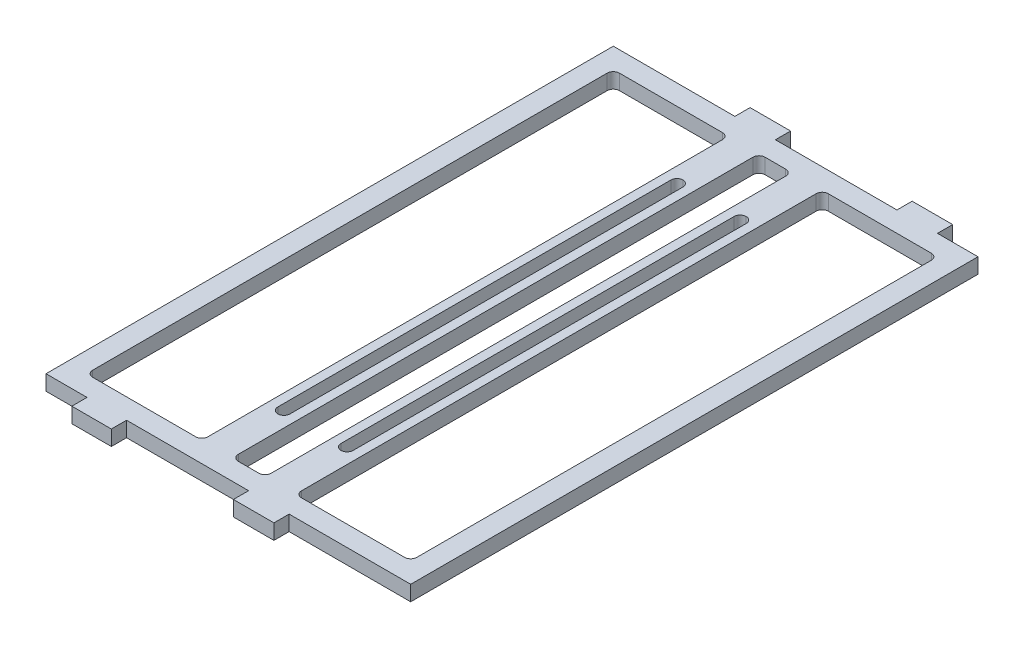
from build123d import *

# Parameters (mm, degrees)
SKETCH1_W           = 114.3
SKETCH1_H           = 177.8
SKETCH1_W_2         = 101.6
SKETCH1_H_2         = 165.1
BOSS_EXTRUDE1_DEPTH = 4.7625
SKETCH2_W           = 12.38677804
SKETCH2_H           = 4.7625
SKETCH2_W_2         = 12.7
BOSS_EXTRUDE2_DEPTH = 4.7625
SKETCH3_W           = 12.7
SKETCH3_H           = 4.7625
BOSS_EXTRUDE3_DEPTH = 4.7625
SKETCH4_W           = 9.525
SKETCH4_H           = 177.8
SKETCH4_W_2         = 3.81
SKETCH4_H_2         = 127
BOSS_EXTRUDE4_DEPTH = 4.7625
FILLET1_R           = 1.905


with BuildPart() as part:
    # Sketch1 → Boss-Extrude1 (new body)
    with BuildSketch(Plane(origin=(0, 0, 0), x_dir=(1, 0, 0), z_dir=(0, 1, 0))):
        Rectangle(SKETCH1_W, SKETCH1_H)
        Rectangle(SKETCH1_W_2, SKETCH1_H_2, mode=Mode.SUBTRACT)
    extrude(amount=BOSS_EXTRUDE1_DEPTH)

    # Sketch2 → Boss-Extrude2 (add)
    with BuildSketch(Plane.XY.offset(88.9)):
        with Locations((-38.1, 2.38125)):
            Rectangle(SKETCH2_W, SKETCH2_H)
        with Locations((12.7, 2.38125)):
            Rectangle(SKETCH2_W_2, SKETCH2_H)
    extrude(amount=BOSS_EXTRUDE2_DEPTH)

    # Sketch3 → Boss-Extrude3 (add)
    with BuildSketch(Plane(origin=(0, 0, -88.9), x_dir=(-1, 0, 0), z_dir=(0, 0, -1))):
        with Locations((-38.1, 2.38125)):
            Rectangle(SKETCH3_W, SKETCH3_H)
        with Locations((12.7, 2.38125)):
            Rectangle(SKETCH3_W, SKETCH3_H)
    extrude(amount=BOSS_EXTRUDE3_DEPTH)

    # Sketch4 → Boss-Extrude4 (add)
    # profile 1 of 2: a face of its own
    with BuildSketch(Plane(origin=(0, 4.7625, 0), x_dir=(-1, 0, 0), z_dir=(0, 1, 0))):
        with Locations((9.906, 0)):
            Rectangle(SKETCH4_W, SKETCH4_H)
        with Locations((9.906, 0)):
            Rectangle(SKETCH4_W_2, SKETCH4_H_2, mode=Mode.SUBTRACT)
    # profile 2 of 2: a face of its own
    with BuildSketch(Plane(origin=(0, 4.7625, 0), x_dir=(-1, 0, 0), z_dir=(0, 1, 0))):
        with Locations((-9.906, 0)):
            Rectangle(SKETCH4_W, SKETCH4_H)
        with Locations((-9.906, 0)):
            Rectangle(SKETCH4_W_2, SKETCH4_H_2, mode=Mode.SUBTRACT)
    extrude(amount=-BOSS_EXTRUDE4_DEPTH)

    # Fillet1
    fillet1_edges = [part.edges().sort_by_distance(p)[0] for p in [
        (-8.001, 2.38125, -63.5),
        (-11.811, 2.38125, -63.5),
        (8.001, 2.38125, -63.5),
        (11.811, 2.38125, -63.5),
        (-8.001, 2.38125, 63.5),
        (-11.811, 2.38125, 63.5),
        (8.001, 2.38125, 63.5),
        (11.811, 2.38125, 63.5),
        (-5.1435, 2.38125, 82.55),
        (5.1435, 2.38125, 82.55),
        (-5.1435, 2.38125, -82.55),
        (5.1435, 2.38125, -82.55),
        (-14.6685, 2.38125, -82.55),
        (-50.8, 2.38125, -82.55),
        (-50.8, 2.38125, 82.55),
        (-14.6685, 2.38125, 82.55),
        (14.6685, 2.38125, 82.55),
        (50.8, 2.38125, 82.55),
        (14.6685, 2.38125, -82.55),
        (50.8, 2.38125, -82.55),
    ]]
    fillet(fillet1_edges, radius=FILLET1_R - 0.0001)  # a hair under: the kernel refuses the full size


solid = part.part
